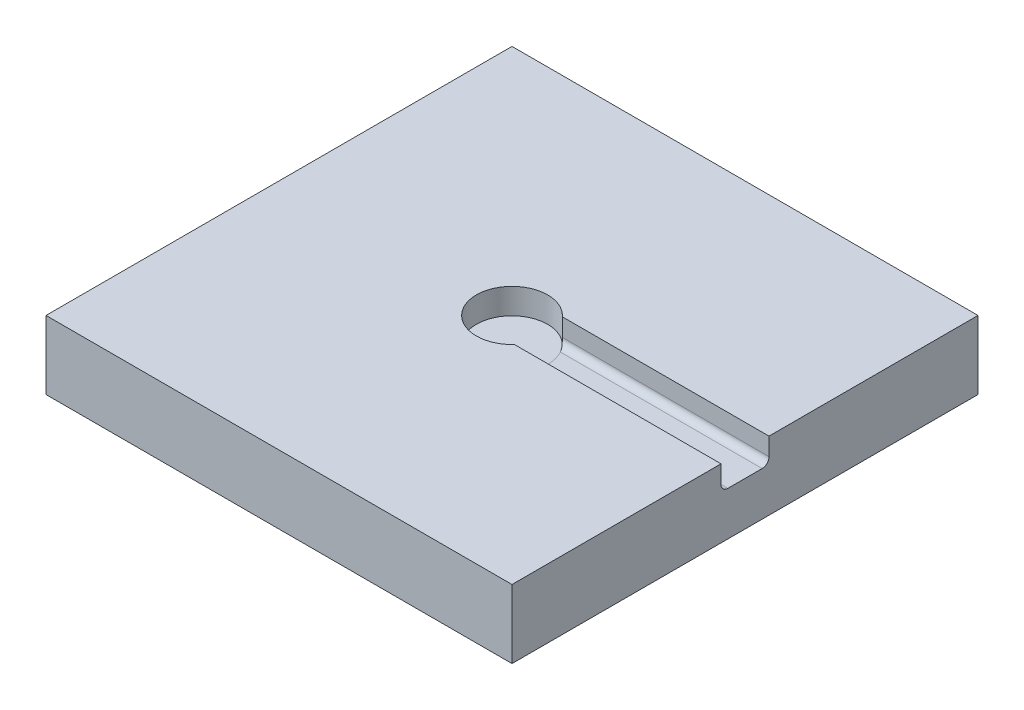
from build123d import *

# Parameters (mm, degrees)
SKETCH1_W           = 340
SKETCH1_H           = 340
BASE_DEPTH          = 50
SKETCH2_R           = 26
LOAD_CELL_CUT_DEPTH = 18.6
SKETCH3_W           = 35
SKETCH3_H           = 18
WIRE_CUT_DEPTH      = 170
WIRE_CUT_FILLET_R   = 5


with BuildPart() as part:
    # Sketch1 → base (new body)
    with BuildSketch(Plane(origin=(0, 0, 0), x_dir=(1, 0, 0), z_dir=(0, 1, 0))):
        Rectangle(SKETCH1_W, SKETCH1_H)
    extrude(amount=BASE_DEPTH)

    # Sketch2 → load cell cut (cut)
    with BuildSketch(Plane(origin=(0, 50, 0), x_dir=(1, 0, 0), z_dir=(0, 1, 0))):
        Circle(SKETCH2_R)
    extrude(amount=-LOAD_CELL_CUT_DEPTH, mode=Mode.SUBTRACT)

    # Sketch3 → wire cut (cut)
    with BuildSketch(Plane(origin=(170, 0, 0), x_dir=(0, 0, -1), z_dir=(1, 0, 0))):
        with Locations((0, 41)):
            Rectangle(SKETCH3_W, SKETCH3_H)
    extrude(amount=-WIRE_CUT_DEPTH, mode=Mode.SUBTRACT)

    # wire cut fillet
    wire_cut_fillet_edges = [part.edges().sort_by_distance(p)[0] for p in [
        (94.614442262, 32, 17.5),
        (94.614442262, 32, -17.5),
    ]]
    fillet(wire_cut_fillet_edges, radius=WIRE_CUT_FILLET_R)


solid = part.part
